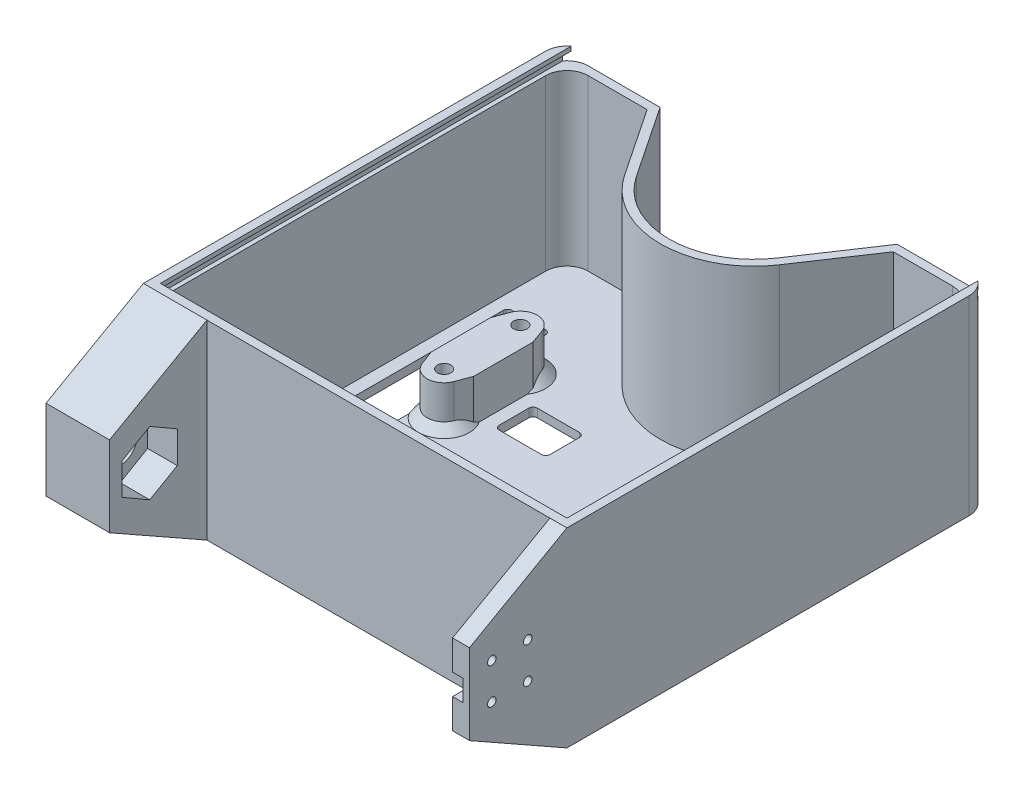
from build123d import *

# Parameters (mm, degrees)
AUFSATZ_LINEAR_AUSTRAGEN1_DEPTH  = 45
WANDUNG1_T                       = -2
SKIZZE1_W                        = 10
SKIZZE1_H                        = 42
SCHNITT_LINEAR_AUSTRAGEN1_DEPTH  = 2
SKIZZE2_R                        = 1.6
AUFSATZ_LINEAR_AUSTRAGEN2_DEPTH  = 10
VERRUNDUNG1_R                    = 1
SKIZZE6_R                        = 1.6
SCHNITT_LINEAR_AUSTRAGEN2_DEPTH  = 79.0320447
SCHNITT_LINEAR_AUSTRAGEN3_DEPTH  = 9
FASE1_SIZE                       = 2
SKIZZE8_W                        = 12
SKIZZE8_H                        = 9
SCHNITT_LINEAR_AUSTRAGEN4_DEPTH  = 2
VERRUNDUNG2_R                    = 1
VERRUNDUNG3_R                    = 5
VERRUNDUNG4_R                    = 5
SCHNITT_LINEAR_AUSTRAGEN5_REACH  = 85.815
SKIZZE14_W                       = 15
SKIZZE14_H                       = 45
SKIZZE14_W_2                     = 4
AUFSATZ_LINEAR_AUSTRAGEN5_DEPTH  = 23
SKIZZE18_R                       = 1
SCHNITT_LINEAR_AUSTRAGEN8_DEPTH  = 4
SCHNITT_LINEAR_AUSTRAGEN9_DEPTH  = 2.5
SKIZZE20_W                       = 5
SKIZZE20_H                       = 10
SCHNITT_LINEAR_AUSTRAGEN10_DEPTH = 2
SKIZZE21_R                       = 4
SCHNITT_LINEAR_AUSTRAGEN11_DEPTH = 15
SKIZZE23_R                       = 7.5
SCHNITT_LINEAR_AUSTRAGEN12_DEPTH = 1
SKIZZE24_R                       = 7.5
SCHNITT_LINEAR_AUSTRAGEN13_DEPTH = 4
SCHNITT_LINEAR_AUSTRAGEN13_DRAFT = -45
SCHNITT_LINEAR_AUSTRAGEN14_DEPTH = 7
SCHNITT_LINEAR_AUSTRAGEN15_REACH = 133.735
SKIZZE31_W                       = 96
SKIZZE31_H                       = 3
SCHNITT_LINEAR_AUSTRAGEN16_DEPTH = 30
SKIZZE32_W                       = 98
SKIZZE32_H                       = 2
SCHNITT_LINEAR_AUSTRAGEN17_DEPTH = 99
SCHNITT_LINEAR_AUSTRAGEN18_REACH = 133.735
AUFSATZ_LINEAR_AUSTRAGEN6_DEPTH  = 12
AUFSATZ_LINEAR_AUSTRAGEN7_DEPTH  = 2
SKIZZE36_R                       = 1.6
SCHNITT_LINEAR_AUSTRAGEN19_DEPTH = 2
FASE2_SIZE                       = 2


with BuildPart() as part:
    # Grundplatte → Aufsatz-Linear austragen1 (new body)
    with BuildSketch(Plane(origin=(0, 0, 0), x_dir=(1, 0, 0), z_dir=(0, 1, 0))):
        with BuildLine():
            Line((-50, 50), (-50, -50))
            Line((-50, -50), (50, -50))
            Line((50, -50), (50, 50))
            Line((50, 50), (28, 50))
            Line((28, 50), (16.61985221, 33))
            ThreePointArc((16.61985221, 33), (0, 24.125669082), (-16.61985221, 33))
            Line((-16.61985221, 33), (-28, 50))
            Line((-28, 50), (-50, 50))
        make_face()
    extrude(amount=AUFSATZ_LINEAR_AUSTRAGEN1_DEPTH)

    # Wandung1
    wandung1_openings = [part.faces().sort_by_distance(p)[0] for p in [
        (0, 45, 4.219695438),
    ]]
    offset(amount=WANDUNG1_T, openings=wandung1_openings, kind=Kind.INTERSECTION)

    # Skizze1 → Schnitt-Linear austragen1 (cut)
    with BuildSketch(Plane(origin=(0, 2, 0), x_dir=(1, 0, 0), z_dir=(0, 1, 0))):
        with Locations((-40, 10)):
            Rectangle(SKIZZE1_W, SKIZZE1_H)
        with Locations((40, 10)):
            Rectangle(SKIZZE1_W, SKIZZE1_H)
    extrude(amount=-SCHNITT_LINEAR_AUSTRAGEN1_DEPTH, mode=Mode.SUBTRACT)

    # Skizze2 → Aufsatz-Linear austragen2 (add)
    # profile 1 of 2: a face of its own
    with BuildSketch(Plane(origin=(0, 2, 0), x_dir=(1, 0, 0), z_dir=(0, 1, 0))):
        with BuildLine():
            Line((-35, 16), (-35, 4))
            Line((-35, 4), (-35, 3))
            Line((-35, 3), (-33.753255524, -0.383138811))
            ThreePointArc((-33.753255524, -0.383138811), (-30, -3), (-26.246744476, -0.383138811))
            Line((-26.246744476, -0.383138811), (-25, 3))
            Line((-25, 3), (-25, 4))
            Line((-25, 4), (-25, 16))
            Line((-25, 16), (-25, 17))
            Line((-25, 17), (-26.246744476, 20.383138811))
            ThreePointArc((-26.246744476, 20.383138811), (-30, 23), (-33.753255524, 20.383138811))
            Line((-33.753255524, 20.383138811), (-35, 17))
            Line((-35, 17), (-35, 16))
        make_face()
        with Locations(Location((-30, 19, 0), (0, 0, 270))):
            Circle(SKIZZE2_R, mode=Mode.SUBTRACT)
        with Locations(Location((-30, 1, 0), (0, 0, 270))):
            Circle(SKIZZE2_R, mode=Mode.SUBTRACT)
    # profile 2 of 2: a face of its own
    with BuildSketch(Plane(origin=(0, 2, 0), x_dir=(1, 0, 0), z_dir=(0, 1, 0))):
        with BuildLine():
            Line((35, 16), (35, 17))
            Line((35, 17), (33.753255524, 20.383138811))
            ThreePointArc((33.753255524, 20.383138811), (30, 23), (26.246744476, 20.383138811))
            Line((26.246744476, 20.383138811), (25, 17))
            Line((25, 17), (25, 16))
            Line((25, 16), (25, 4))
            Line((25, 4), (25, 3))
            Line((25, 3), (26.246744476, -0.383138811))
            ThreePointArc((26.246744476, -0.383138811), (30, -3), (33.753255524, -0.383138811))
            Line((33.753255524, -0.383138811), (35, 3))
            Line((35, 3), (35, 4))
            Line((35, 4), (35, 16))
        make_face()
        with Locations(Location((30, 1, 0), (0, 0, 90))):
            Circle(SKIZZE2_R, mode=Mode.SUBTRACT)
        with Locations(Location((30, 19, 0), (0, 0, 90))):
            Circle(SKIZZE2_R, mode=Mode.SUBTRACT)
    extrude(amount=AUFSATZ_LINEAR_AUSTRAGEN2_DEPTH)

    # Verrundung1
    verrundung1_edges = [part.edges().sort_by_distance(p)[0] for p in [
        (-35, 1, -31),
        (-35, 1, 11),
        (-45, 1, 11),
        (-45, 1, -31),
        (45, 1, -31),
        (45, 1, 11),
        (35, 1, 11),
        (35, 1, -31),
    ]]
    fillet(verrundung1_edges, radius=VERRUNDUNG1_R)

    # Skizze6 → Schnitt-Linear austragen2 (cut, through all)
    with BuildSketch(Plane(origin=(0, 12, 0), x_dir=(1, 0, 0), z_dir=(0, 1, 0))):
        with Locations(Location((-30, 19, 0), (0, 0, 270))):
            Circle(SKIZZE6_R)
        with Locations(Location((-30, 1, 0), (0, 0, 270))):
            Circle(SKIZZE6_R)
        with Locations(Location((30, 19, 0), (0, 0, 90))):
            Circle(SKIZZE6_R)
        with Locations(Location((30, 1, 0), (0, 0, 90))):
            Circle(SKIZZE6_R)
    extrude(amount=-SCHNITT_LINEAR_AUSTRAGEN2_DEPTH, mode=Mode.SUBTRACT)

    # Skizze7 → Schnitt-Linear austragen3 (cut)
    with BuildSketch(Plane.XZ):
        Polygon((-26.709103466, -1), (-28.354551733, 1.85), (-31.645448267, 1.85), (-33.290896534, -1), (-31.645448267, -3.85), (-28.354551733, -3.85), align=None)
        Polygon((28.354551733, -21.85), (26.709103466, -19), (28.354551733, -16.15), (31.645448267, -16.15), (33.290896534, -19), (31.645448267, -21.85), align=None)
        Polygon((-26.709103466, -19), (-28.354551733, -16.15), (-31.645448267, -16.15), (-33.290896534, -19), (-31.645448267, -21.85), (-28.354551733, -21.85), align=None)
        Polygon((28.354551733, -3.85), (26.709103466, -1), (28.354551733, 1.85), (31.645448267, 1.85), (33.290896534, -1), (31.645448267, -3.85), align=None)
    extrude(amount=-SCHNITT_LINEAR_AUSTRAGEN3_DEPTH, mode=Mode.SUBTRACT)

    # Fase1
    # the kernel refuses this chamfer: 2 mm, written as the material it adds along each edge
    with BuildSketch(Plane(origin=(33.753255524, 2, 0.383138811), x_dir=(0.9379591204561566, -0.02749587661058633, 0.3456539673177909), z_dir=(0.3457847026662013, 0, -0.9383138810664834))) as fase1_piece_1_section:
        Polygon((FASE1_SIZE * 0.999621916911, -FASE1_SIZE * 0.0274958766106), (-FASE1_SIZE * 0.0274958766106, -FASE1_SIZE * 0.999621916911), (0, 0), align=None)
    fase1_piece_1 = extrude(amount=8.748917251, mode=Mode.PRIVATE)
    fase1_piece_1 = split(fase1_piece_1, bisect_by=Plane(origin=(35, 2.810043693, -0.69339811), z_dir=(-1, 0, 0)), keep=Keep.TOP, mode=Mode.PRIVATE)
    add(fase1_piece_1)
    with BuildSketch(Plane(origin=(30, 2, -1), x_dir=(-0.5946157089023157, 0, -0.8040100488965276), z_dir=(0.8040100488965276, 0, -0.5946157089023157))) as fase1_piece_2_section:
        Polygon((4 + FASE1_SIZE, 0), (4, FASE1_SIZE), (4, 0), align=None)
    fase1_piece_2 = revolve(axis=Axis((30, 2, -1), (0, 1, 0)), revolution_arc=213.285054007, mode=Mode.PRIVATE)
    fase1_piece_2 = split(fase1_piece_2, bisect_by=Plane(origin=(35, 2.618842305, 0.921149391), z_dir=(-1, 0, 0)), keep=Keep.TOP, mode=Mode.PRIVATE)
    add(fase1_piece_2)
    with BuildSketch(Plane(origin=(36.778497275, 2, -12.173908309), x_dir=(0.937959120456157, -0.027495876610586348, -0.34565396731779), z_dir=(-0.34578470266620037, 0, -0.9383138810664838))) as fase1_piece_3_section:
        Polygon((FASE1_SIZE * 0.999621916911, -FASE1_SIZE * 0.0274958766106), (-FASE1_SIZE * 0.0274958766106, -FASE1_SIZE * 0.999621916911), (0, 0), align=None)
    fase1_piece_3 = extrude(amount=8.748917251, mode=Mode.PRIVATE)
    fase1_piece_3 = split(fase1_piece_3, bisect_by=Plane(origin=(35, 2.810043693, -19.30660189), z_dir=(-1, 0, 0)), keep=Keep.TOP, mode=Mode.PRIVATE)
    add(fase1_piece_3)
    with BuildSketch(Plane(origin=(30, 2, -19), x_dir=(0.9383138810664835, 0, -0.3457847026662016), z_dir=(0.3457847026662016, 0, 0.9383138810664835))) as fase1_piece_4_section:
        Polygon((4 + FASE1_SIZE, 0), (4, FASE1_SIZE), (4, 0), align=None)
    fase1_piece_4 = revolve(axis=Axis((30, 2, -19), (0, 1, 0)), revolution_arc=213.285054007, mode=Mode.PRIVATE)
    fase1_piece_4 = split(fase1_piece_4, bisect_by=Plane(origin=(35, 2.568302244, -21.912371656), z_dir=(-1, 0, 0)), keep=Keep.TOP, mode=Mode.PRIVATE)
    add(fase1_piece_4)
    with BuildSketch(Plane(origin=(-33.753255524, 2, -20.383138811), x_dir=(-0.9379591204561563, -0.02749587661058632, -0.34565396731779174), z_dir=(-0.34578470266620215, 0, 0.9383138810664832))) as fase1_piece_5_section:
        Polygon((FASE1_SIZE * 0.999621916911, -FASE1_SIZE * 0.0274958766106), (-FASE1_SIZE * 0.0274958766106, -FASE1_SIZE * 0.999621916911), (0, 0), align=None)
    fase1_piece_5 = extrude(amount=8.748917251, mode=Mode.PRIVATE)
    fase1_piece_5 = split(fase1_piece_5, bisect_by=Plane(origin=(-35, 2.810043693, -19.30660189), z_dir=(1, 0, 0)), keep=Keep.TOP, mode=Mode.PRIVATE)
    add(fase1_piece_5)
    with BuildSketch(Plane(origin=(-30, 2, -19), x_dir=(0.5946157089023089, 0, 0.8040100488965327), z_dir=(-0.8040100488965327, 0, 0.5946157089023089))) as fase1_piece_6_section:
        Polygon((4 + FASE1_SIZE, 0), (4, FASE1_SIZE), (4, 0), align=None)
    fase1_piece_6 = revolve(axis=Axis((-30, 2, -19), (0, 1, 0)), revolution_arc=213.285054007, mode=Mode.PRIVATE)
    fase1_piece_6 = split(fase1_piece_6, bisect_by=Plane(origin=(-35, 2.618842305, -20.921149391), z_dir=(1, 0, 0)), keep=Keep.TOP, mode=Mode.PRIVATE)
    add(fase1_piece_6)
    with BuildSketch(Plane(origin=(-36.778497275, 2, -7.826091691), x_dir=(-0.937959120456156, -0.02749587661058632, 0.3456539673177927), z_dir=(0.3457847026662031, 0, 0.9383138810664828))) as fase1_piece_7_section:
        Polygon((FASE1_SIZE * 0.999621916911, -FASE1_SIZE * 0.0274958766106), (-FASE1_SIZE * 0.0274958766106, -FASE1_SIZE * 0.999621916911), (0, 0), align=None)
    fase1_piece_7 = extrude(amount=8.748917251, mode=Mode.PRIVATE)
    fase1_piece_7 = split(fase1_piece_7, bisect_by=Plane(origin=(-35, 2.810043693, -0.69339811), z_dir=(1, 0, 0)), keep=Keep.TOP, mode=Mode.PRIVATE)
    add(fase1_piece_7)
    with BuildSketch(Plane(origin=(-30, 2, -1), x_dir=(-0.9383138810664808, 0, 0.34578470266620803), z_dir=(-0.34578470266620803, 0, -0.9383138810664808))) as fase1_piece_8_section:
        Polygon((4 + FASE1_SIZE, 0), (4, FASE1_SIZE), (4, 0), align=None)
    fase1_piece_8 = revolve(axis=Axis((-30, 2, -1), (0, 1, 0)), revolution_arc=213.285054007, mode=Mode.PRIVATE)
    fase1_piece_8 = split(fase1_piece_8, bisect_by=Plane(origin=(-35, 2.568302244, 1.912371656), z_dir=(1, 0, 0)), keep=Keep.TOP, mode=Mode.PRIVATE)
    add(fase1_piece_8)

    # Skizze8 → Schnitt-Linear austragen4 (cut)
    with BuildSketch(Plane.XZ):
        with Locations((16, -9.5)):
            Rectangle(SKIZZE8_W, SKIZZE8_H)
        with Locations((-16, -9.5)):
            Rectangle(SKIZZE8_W, SKIZZE8_H)
    extrude(amount=-SCHNITT_LINEAR_AUSTRAGEN4_DEPTH, mode=Mode.SUBTRACT)

    # Verrundung2
    verrundung2_edges = [part.edges().sort_by_distance(p)[0] for p in [
        (-10, 1, -14),
        (-10, 1, -5),
        (-22, 1, -5),
        (-22, 1, -14),
        (10, 1, -5),
        (10, 1, -14),
        (22, 1, -14),
        (22, 1, -5),
    ]]
    fillet(verrundung2_edges, radius=VERRUNDUNG2_R)

    # Verrundung3
    verrundung3_edges = [part.edges().sort_by_distance(p)[0] for p in [
        (-50, 22.5, -50),
        (50, 22.5, -50),
    ]]
    fillet(verrundung3_edges, radius=VERRUNDUNG3_R)

    # Verrundung4
    verrundung4_edges = [part.edges().sort_by_distance(p)[0] for p in [
        (48, 23.5, -48),
        (-48, 23.5, -48),
    ]]
    fillet(verrundung4_edges, radius=VERRUNDUNG4_R)

    # Skizze9 → Schnitt-Linear austragen5 (cut, up to next)
    with BuildSketch(Plane.XZ, mode=Mode.PRIVATE) as schnitt_linear_austragen5_sk1:
        with BuildLine():
            Line((-10.8, 43), (10.8, 43))
            ThreePointArc((10.8, 43), (11.648528137, 42.648528137), (12, 41.8))
            Line((12, 41.8), (12, 28.2))
            ThreePointArc((12, 28.2), (11.648528137, 27.351471863), (10.8, 27))
            Line((10.8, 27), (-10.8, 27))
            ThreePointArc((-10.8, 27), (-11.648528137, 27.351471863), (-12, 28.2))
            Line((-12, 28.2), (-12, 41.8))
            ThreePointArc((-12, 41.8), (-11.648528137, 42.648528137), (-10.8, 43))
        make_face()
    schnitt_linear_austragen5_tool1 = extrude(schnitt_linear_austragen5_sk1.sketch, amount=-SCHNITT_LINEAR_AUSTRAGEN5_REACH, mode=Mode.PRIVATE) & part.part
    add(schnitt_linear_austragen5_tool1.solids().sort_by_distance((0, 0, 35))[0], mode=Mode.SUBTRACT)

    # Skizze14 → Aufsatz-Linear austragen5 (add)
    with BuildSketch(Plane.XY.offset(50)):
        with Locations((-42.5, 22.5)):
            Rectangle(SKIZZE14_W, SKIZZE14_H)
        with Locations((48, 22.5)):
            Rectangle(SKIZZE14_W_2, SKIZZE14_H)
    extrude(amount=AUFSATZ_LINEAR_AUSTRAGEN5_DEPTH)

    # Skizze18 → Schnitt-Linear austragen8 (cut)
    with BuildSketch(Plane(origin=(50, 0, 0), x_dir=(0, 0, -1), z_dir=(1, 0, 0))):
        with Locations((-59.257359313, 18.257359313)):
            Circle(SKIZZE18_R)
        with Locations((-67.742640687, 18.257359313)):
            Circle(SKIZZE18_R)
        with Locations((-67.742640687, 26.742640687)):
            Circle(SKIZZE18_R)
        with Locations((-59.257359313, 26.742640687)):
            Circle(SKIZZE18_R)
    extrude(amount=-SCHNITT_LINEAR_AUSTRAGEN8_DEPTH, mode=Mode.SUBTRACT)

    # Skizze19 → Schnitt-Linear austragen9 (cut)
    with BuildSketch(Plane.ZY.offset(-46)):
        with BuildLine():
            Line((63.5, 25), (73, 25))
            Line((73, 25), (73, 20))
            Line((73, 20), (63.5, 20))
            ThreePointArc((63.5, 20), (61, 22.5), (63.5, 25))
        make_face()
    extrude(amount=-SCHNITT_LINEAR_AUSTRAGEN9_DEPTH, mode=Mode.SUBTRACT)

    # Skizze20 → Schnitt-Linear austragen10 (cut)
    with BuildSketch(Plane.XY.offset(50)):
        with Locations((43.5, 22.5)):
            Rectangle(SKIZZE20_W, SKIZZE20_H)
    extrude(amount=-SCHNITT_LINEAR_AUSTRAGEN10_DEPTH, mode=Mode.SUBTRACT)

    # Skizze21 → Schnitt-Linear austragen11 (cut)
    with BuildSketch(Plane.ZY.offset(50)):
        with Locations((63.5, 22.5)):
            Circle(SKIZZE21_R)
    extrude(amount=-SCHNITT_LINEAR_AUSTRAGEN11_DEPTH, mode=Mode.SUBTRACT)

    # Skizze23 → Schnitt-Linear austragen12 (cut)
    with BuildSketch(Plane.ZY.offset(50)):
        with Locations((63.5, 22.5)):
            Circle(SKIZZE23_R)
    extrude(amount=-SCHNITT_LINEAR_AUSTRAGEN12_DEPTH, mode=Mode.SUBTRACT)


with BuildPart() as schnitt_linear_austragen13_tool:
    # Skizze24 → Schnitt-Linear austragen13 (with draft: the straight prism first)
    with BuildSketch(Plane.ZY.offset(49)):
        with Locations((63.5, 22.5)):
            Circle(SKIZZE24_R)
    extrude(amount=-SCHNITT_LINEAR_AUSTRAGEN13_DEPTH)
    # Schnitt-Linear austragen13: the draft: its side faces are tilted about the plane it starts from
    schnitt_linear_austragen13_sides = [schnitt_linear_austragen13_tool.faces().sort_by_distance(p)[0] for p in [
        (-47, 22.5, 56),
    ]]
    draft(schnitt_linear_austragen13_sides, Plane.ZY.offset(49), SCHNITT_LINEAR_AUSTRAGEN13_DRAFT)


with BuildPart() as part_1:
    add(part.part)

    # Schnitt-Linear austragen13: cut by schnitt_linear_austragen13_tool
    add(schnitt_linear_austragen13_tool.part, mode=Mode.SUBTRACT)

    # Skizze26 → Schnitt-Linear austragen14 (cut)
    with BuildSketch(Plane(origin=(-35, 0, 0), x_dir=(0, 0, -1), z_dir=(1, 0, 0))):
        Polygon((-57, 18.74722325), (-57, 26.25277675), (-63.5, 30.005553499), (-70, 26.25277675), (-70, 18.74722325), (-63.5, 14.994446501), align=None)
    extrude(amount=-SCHNITT_LINEAR_AUSTRAGEN14_DEPTH, mode=Mode.SUBTRACT)

    # Schnitt-Linear austragen15: up to this face of the body (flat: up to its plane)
    schnitt_linear_austragen15_end = Plane(part_1.part.faces().sort_by_distance((50, 22.5, 13.882577982))[0])
    # Skizze29 → Schnitt-Linear austragen15 (cut, up to the picked face)
    with BuildSketch(Plane.ZY.offset(50), mode=Mode.PRIVATE) as schnitt_linear_austragen15_sk1:
        Polygon((73, 45), (73, 32), (50, 45), align=None)
    schnitt_linear_austragen15_tool1 = split(extrude(schnitt_linear_austragen15_sk1.sketch, amount=-SCHNITT_LINEAR_AUSTRAGEN15_REACH, mode=Mode.PRIVATE), bisect_by=schnitt_linear_austragen15_end, keep=Keep.BOTH, mode=Mode.PRIVATE)
    add(schnitt_linear_austragen15_tool1.solids().sort_by(Axis((-50, 40.666667, 65.333333), (1, 0, 0)))[0], mode=Mode.SUBTRACT)

    # Skizze31 → Schnitt-Linear austragen16 (cut)
    with BuildSketch(Plane(origin=(0, 0, -50), x_dir=(-1, 0, 0), z_dir=(0, 0, -1))):
        with Locations((0, 43.5)):
            Rectangle(SKIZZE31_W, SKIZZE31_H)
    extrude(amount=-SCHNITT_LINEAR_AUSTRAGEN16_DEPTH, mode=Mode.SUBTRACT)

    # Skizze32 → Schnitt-Linear austragen17 (cut)
    with BuildSketch(Plane(origin=(0, 0, -50), x_dir=(-1, 0, 0), z_dir=(0, 0, -1))):
        with Locations((0, 43)):
            Rectangle(SKIZZE32_W, SKIZZE32_H)
    extrude(amount=-SCHNITT_LINEAR_AUSTRAGEN17_DEPTH, mode=Mode.SUBTRACT)

    # Schnitt-Linear austragen18: up to this face of the body (flat: up to its plane)
    schnitt_linear_austragen18_end = Plane(part_1.part.faces().sort_by_distance((-50, 21.955049437, 10.704973426))[0])
    # Skizze33 → Schnitt-Linear austragen18 (cut, up to the picked face)
    with BuildSketch(Plane(origin=(50, 0, 0), x_dir=(0, 0, -1), z_dir=(1, 0, 0)), mode=Mode.PRIVATE) as schnitt_linear_austragen18_sk1:
        Polygon((-50, 0), (-73, 13), (-73, 0), align=None)
    schnitt_linear_austragen18_tool1 = split(extrude(schnitt_linear_austragen18_sk1.sketch, amount=-SCHNITT_LINEAR_AUSTRAGEN18_REACH, mode=Mode.PRIVATE), bisect_by=schnitt_linear_austragen18_end, keep=Keep.BOTH, mode=Mode.PRIVATE)
    add(schnitt_linear_austragen18_tool1.solids().sort_by(Axis((50, 4.333333, 65.333333), (-1, 0, 0)))[0], mode=Mode.SUBTRACT)

    # Skizze34 → Aufsatz-Linear austragen6 (add)
    with BuildSketch(Plane(origin=(0, 2, 0), x_dir=(1, 0, 0), z_dir=(0, 1, 0))):
        with BuildLine():
            Line((14, -41.8), (14, -28.2))
            ThreePointArc((14, -28.2), (13.0627417, -25.9372583), (10.8, -25))
            Line((10.8, -25), (-10.8, -25))
            ThreePointArc((-10.8, -25), (-13.0627417, -25.9372583), (-14, -28.2))
            Line((-14, -28.2), (-14, -41.8))
            ThreePointArc((-14, -41.8), (-13.0627417, -44.0627417), (-10.8, -45))
            Line((-10.8, -45), (10.8, -45))
            ThreePointArc((10.8, -45), (13.0627417, -44.0627417), (14, -41.8))
        make_face()
        with BuildLine():
            Line((10.8, -27), (-10.8, -27))
            ThreePointArc((-10.8, -27), (-11.648528137, -27.351471863), (-12, -28.2))
            Line((-12, -28.2), (-12, -41.8))
            ThreePointArc((-12, -41.8), (-11.648528137, -42.648528137), (-10.8, -43))
            Line((-10.8, -43), (10.8, -43))
            ThreePointArc((10.8, -43), (11.648528137, -42.648528137), (12, -41.8))
            Line((12, -41.8), (12, -28.2))
            ThreePointArc((12, -28.2), (11.648528137, -27.351471863), (10.8, -27))
        make_face(mode=Mode.SUBTRACT)
    extrude(amount=AUFSATZ_LINEAR_AUSTRAGEN6_DEPTH)

    # Skizze35 → Aufsatz-Linear austragen7 (add)
    with BuildSketch(Plane(origin=(0, 14, 0), x_dir=(1, 0, 0), z_dir=(0, 1, 0))):
        with BuildLine():
            Line((14, -41.8), (14, -28.2))
            ThreePointArc((14, -28.2), (13.0627417, -25.9372583), (10.8, -25))
            Line((10.8, -25), (-10.8, -25))
            ThreePointArc((-10.8, -25), (-13.0627417, -25.9372583), (-14, -28.2))
            Line((-14, -28.2), (-14, -41.8))
            ThreePointArc((-14, -41.8), (-13.0627417, -44.0627417), (-10.8, -45))
            Line((-10.8, -45), (10.8, -45))
            ThreePointArc((10.8, -45), (13.0627417, -44.0627417), (14, -41.8))
        make_face()
    extrude(amount=AUFSATZ_LINEAR_AUSTRAGEN7_DEPTH)

    # Skizze36 → Schnitt-Linear austragen19 (cut)
    with BuildSketch(Plane(origin=(0, 16, 0), x_dir=(1, 0, 0), z_dir=(0, 1, 0))):
        with Locations(Location((8, -35, 0), (0, 0, 270))):
            Circle(SKIZZE36_R)
        with Locations(Location((-8, -35, 0), (0, 0, 270))):
            Circle(SKIZZE36_R)
    extrude(amount=-SCHNITT_LINEAR_AUSTRAGEN19_DEPTH, mode=Mode.SUBTRACT)

    # Fase2
    fase2_edges = [part_1.edges().sort_by_distance(p)[0] for p in [
        (13.0627417, 2, 25.9372583),
        (0, 2, 25),
        (-13.0627417, 2, 25.9372583),
        (-14, 2, 35),
        (-13.0627417, 2, 44.0627417),
        (0, 2, 45),
        (13.0627417, 2, 44.0627417),
        (14, 2, 35),
    ]]
    chamfer(fase2_edges, length=FASE2_SIZE)


solid = part_1.part
